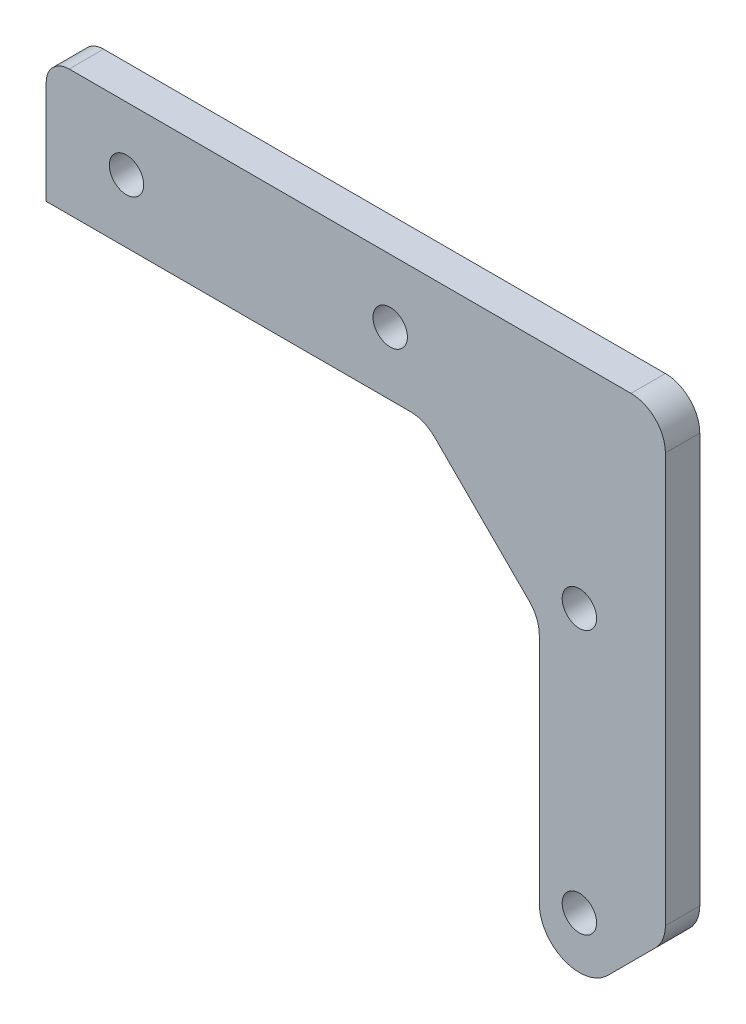
from build123d import *

# Parameters (mm, degrees)
SKETCH_1_R         = 1.5
EXTRUDE_1127_DEPTH = 3
FILLET1_R          = 3
FILLET_1_R         = 2


with BuildPart() as part:
    # Эскиз1 → Extrude 1127 (new body)
    with BuildSketch(Plane.XY):
        with BuildLine():
            Line((-48.5, 5.5), (-48.5, -5.5))
            Line((-48.5, -5.5), (-15.5, -5.5))
            Line((-15.5, -5.5), (-5.5, -15.5))
            Line((-5.5, -15.5), (-5.5, -37))
            ThreePointArc((-5.5, -37), (-3.339392013, -40.233578364), (0.474873734, -39.474873734))
            Line((0.474873734, -39.474873734), (5.5, -34.449747468))
            Line((5.5, -34.449747468), (5.5, 5.5))
            Line((5.5, 5.5), (-48.5, 5.5))
        make_face()
        with Locations((-18.5, 0)):
            Circle(SKETCH_1_R, mode=Mode.SUBTRACT)
        with Locations((-41.5, 0)):
            Circle(SKETCH_1_R, mode=Mode.SUBTRACT)
        with Locations((-2, -13)):
            Circle(SKETCH_1_R, mode=Mode.SUBTRACT)
        with Locations((-2, -36)):
            Circle(SKETCH_1_R, mode=Mode.SUBTRACT)
    extrude(amount=EXTRUDE_1127_DEPTH)

    # Fillet1
    fillet1_edges = [part.edges().sort_by_distance(p)[0] for p in [
        (5.5, 5.5, 1.5),
        (5.5, -34.449747468, 1.5),
        (-5.5, -15.5, 1.5),
        (-15.5, -5.5, 1.5),
    ]]
    fillet(fillet1_edges, radius=FILLET1_R)

    # Скругление1
    fillet_1_edges = [part.edges().sort_by_distance(p)[0] for p in [
        (-48.5, 5.5, 1.5),
    ]]
    fillet(fillet_1_edges, radius=FILLET_1_R)


solid = part.part
